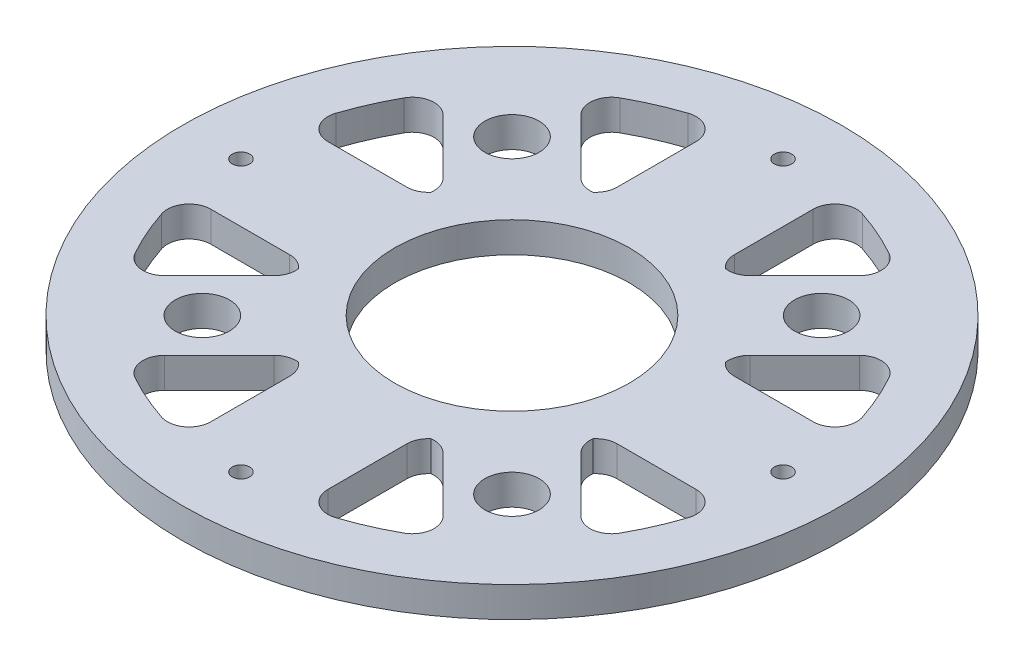
from build123d import *

# Parameters (mm, degrees)
SKETCH1_R           = 76
SKETCH1_R_2         = 27.051
SKETCH1_R_3         = 2
BOSS_EXTRUDE1_DEPTH = 7
SKETCH4_R           = 6.25
CUT_EXTRUDE1_DEPTH  = 10
FILLET1_R           = 5


with BuildPart() as part:
    # Sketch1 → Boss-Extrude1 (new body)
    with BuildSketch(Plane(origin=(0, 0, 0), x_dir=(1, 0, 0), z_dir=(0, 1, 0))):
        with Locations(Location((0, 0, 0), (0, 0, 270))):
            Circle(SKETCH1_R)
        with Locations(Location((0, 0, 0), (0, 0, 270))):
            Circle(SKETCH1_R_2, mode=Mode.SUBTRACT)
        with Locations(Location((0, 62.5, 0), (0, 0, 270))):
            Circle(SKETCH1_R_3, mode=Mode.SUBTRACT)
        with Locations(Location((62.5, 0, 0), (0, 0, 270))):
            Circle(SKETCH1_R_3, mode=Mode.SUBTRACT)
        with Locations(Location((0, -62.5, 0), (0, 0, 270))):
            Circle(SKETCH1_R_3, mode=Mode.SUBTRACT)
        with Locations(Location((-62.5, 0, 0), (0, 0, 270))):
            Circle(SKETCH1_R_3, mode=Mode.SUBTRACT)
    extrude(amount=BOSS_EXTRUDE1_DEPTH)

    # Sketch4 → Cut-Extrude1 (cut)
    with BuildSketch(Plane(origin=(0, 7, 0), x_dir=(1, 0, 0), z_dir=(0, 1, 0))):
        with BuildLine():
            Line((27.751246841, -43.661149418), (17.007161012, -32.917063589))
            ThreePointArc((17.007161012, -32.917063589), (15.274204293, -33.756114768), (13.5, -34.504008477))
            Line((13.5, -34.504008477), (13.5, -62.5))
            ThreePointArc((13.5, -62.5), (25.524772494, -58.625813335), (36.553123822, -52.463026398))
            Line((36.553123822, -52.463026398), (27.751246841, -43.661149418))
        make_face()
        with BuildLine():
            Line((62.5, -13.5), (34.504008477, -13.5))
            ThreePointArc((34.504008477, -13.5), (33.756114768, -15.274204293), (32.917063589, -17.007161012))
            Line((32.917063589, -17.007161012), (43.66114941, -27.751246833))
            Line((43.66114941, -27.751246833), (52.463026398, -36.553123822))
            ThreePointArc((52.463026398, -36.553123822), (58.625813335, -25.524772494), (62.5, -13.5))
        make_face()
        with BuildLine():
            ThreePointArc((-13.5, -34.504008477), (-15.274204293, -33.756114768), (-17.007161012, -32.917063589))
            Line((-17.007161012, -32.917063589), (-27.751246874, -43.66114945))
            Line((-27.751246874, -43.66114945), (-36.553123822, -52.463026398))
            ThreePointArc((-36.553123822, -52.463026398), (-25.524772494, -58.625813335), (-13.5, -62.5))
            Line((-13.5, -62.5), (-13.5, -34.504008477))
        make_face()
        with BuildLine():
            ThreePointArc((-32.917063589, -17.007161012), (-33.756114768, -15.274204293), (-34.504008477, -13.5))
            Line((-34.504008477, -13.5), (-62.5, -13.5))
            ThreePointArc((-62.5, -13.5), (-58.625813335, -25.524772494), (-52.463026398, -36.553123822))
            Line((-52.463026398, -36.553123822), (-43.661149471, -27.751246894))
            Line((-43.661149471, -27.751246894), (-32.917063589, -17.007161012))
        make_face()
        with BuildLine():
            ThreePointArc((-34.504008477, 13.5), (-33.756114768, 15.274204293), (-32.917063589, 17.007161012))
            Line((-32.917063589, 17.007161012), (-43.66114943, 27.751246854))
            Line((-43.66114943, 27.751246854), (-52.463026398, 36.553123822))
            ThreePointArc((-52.463026398, 36.553123822), (-58.625813335, 25.524772494), (-62.5, 13.5))
            Line((-62.5, 13.5), (-34.504008477, 13.5))
        make_face()
        with BuildLine():
            ThreePointArc((-17.007161012, 32.917063589), (-15.274204293, 33.756114768), (-13.5, 34.504008477))
            Line((-13.5, 34.504008477), (-13.5, 62.5))
            ThreePointArc((-13.5, 62.5), (-25.524772494, 58.625813335), (-36.553123822, 52.463026398))
            Line((-36.553123822, 52.463026398), (-27.751246874, 43.66114945))
            Line((-27.751246874, 43.66114945), (-17.007161012, 32.917063589))
        make_face()
        with BuildLine():
            ThreePointArc((36.553123822, 52.463026398), (25.524772494, 58.625813335), (13.5, 62.5))
            Line((13.5, 62.5), (13.5, 34.504008477))
            ThreePointArc((13.5, 34.504008477), (15.274204293, 33.756114768), (17.007161012, 32.917063589))
            Line((17.007161012, 32.917063589), (27.751246906, 43.661149483))
            Line((27.751246906, 43.661149483), (36.553123822, 52.463026398))
        make_face()
        with BuildLine():
            ThreePointArc((62.5, 13.5), (58.625813335, 25.524772494), (52.463026398, 36.553123822))
            Line((52.463026398, 36.553123822), (43.66114945, 27.751246874))
            Line((43.66114945, 27.751246874), (32.917063589, 17.007161012))
            ThreePointArc((32.917063589, 17.007161012), (33.756114768, 15.274204293), (34.504008477, 13.5))
            Line((34.504008477, 13.5), (62.5, 13.5))
        make_face()
        with Locations(Location((35.706198162, 35.706198162, 0), (0, 0, 270))):
            Circle(SKETCH4_R)
        with Locations(Location((35.706198162, -35.706198162, 0), (0, 0, 270))):
            Circle(SKETCH4_R)
        with Locations(Location((-35.706198162, -35.706198162, 0), (0, 0, 270))):
            Circle(SKETCH4_R)
        with Locations(Location((-35.706198162, 35.706198162, 0), (0, 0, 270))):
            Circle(SKETCH4_R)
    extrude(amount=-CUT_EXTRUDE1_DEPTH, mode=Mode.SUBTRACT)

    # Fillet1
    # the kernel refuses this fillet: 5 mm, written as the material it adds along each edge
    with BuildSketch(Plane(origin=(34.504008477, 7, 13.5), x_dir=(1, 0, 0), z_dir=(0, -1, 0)), Plane(origin=(13.5, 7, -34.504008477), x_dir=(0, 0, -1), z_dir=(0, -1, 0)), Plane(origin=(-34.504008477, 7, -13.5), x_dir=(-1, 0, 0), z_dir=(0, -1, 0)), Plane(origin=(-13.5, 7, 34.504008477), x_dir=(0, 0, 1), z_dir=(0, -1, 0))) as fillet1_piece_1:
        with BuildLine():
            CenterArc((3.258891319, 5), FILLET1_R, 206.100178987, 63.899821013)
            ThreePointArc((-1.231239688, 2.800290124), (-0.586707725, 1.412857227), (0, 0))
            Line((0, 0), (3.258891319, 0))
        make_face()
    extrude(amount=7)
    with BuildSketch(Plane(origin=(62.5, 7, 13.5), x_dir=(-1, 0, 0), z_dir=(0, -1, 0))) as fillet1_piece_2:
        with BuildLine():
            CenterArc((6.537189081, -5), FILLET1_R, 90, 108.2926811)
            ThreePointArc((1.789861186, -6.569355874), (0.807426008, -3.308519097), (0, 0))
            Line((0, 0), (6.537189081, 0))
        make_face()
    extrude(amount=7)
    with BuildSketch(Plane(origin=(52.463026398, 7, 36.553123822), x_dir=(-0.7071067811865521, 0, -0.707106781186543), z_dir=(0, -1, 0)), Plane(origin=(-36.553123822, 7, 52.463026398), x_dir=(0.7071067811865515, 0, -0.7071067811865436), z_dir=(0, -1, 0))) as fillet1_piece_3:
        with BuildLine():
            CenterArc((6.286852353, 5), FILLET1_R, 163.996405934, 106.003594066)
            ThreePointArc((1.480630334, 6.378488268), (0.658610883, 3.208210045), (0, 0))
            Line((0, 0), (6.286852353, 0))
        make_face()
    extrude(amount=7)
    with BuildSketch(Plane(origin=(32.917063589, 7, 17.007161012), x_dir=(0.4193809358930841, 0, -0.907810349472532), z_dir=(0, -1, 0)), Plane(origin=(17.007161012, 7, -32.917063589), x_dir=(-0.9078103494725283, 0, -0.41938093589309267), z_dir=(0, -1, 0)), Plane(origin=(-32.917063589, 7, -17.007161012), x_dir=(-0.4193809358930852, 0, 0.9078103494725317), z_dir=(0, -1, 0))) as fillet1_piece_4:
        with BuildLine():
            CenterArc((3.489548398, 4.995132399), FILLET1_R, 200.204490443, 67.267112024)
            Line((-1.202781391, 3.268273647), (0, 0))
            ThreePointArc((0, 0), (1.634487847, 0.036069898), (3.268975694, 0))
        make_face()
    extrude(amount=7)
    with BuildSketch(Plane(origin=(32.917063589, 7, -17.007161012), x_dir=(0.7071067811865526, 0, -0.7071067811865425), z_dir=(0, -1, 0)), Plane(origin=(-17.007161012, 7, -32.917063589), x_dir=(-0.7071067811865506, 0, -0.7071067811865445), z_dir=(0, -1, 0)), Plane(origin=(-32.917063589, 7, 17.007161012), x_dir=(-0.7071067811865506, 0, 0.7071067811865445), z_dir=(0, -1, 0)), Plane(origin=(17.007161012, 7, 32.917063589), x_dir=(0.7071067811865501, 0, 0.707106781186545), z_dir=(0, -1, 0))) as fillet1_piece_5:
        with BuildLine():
            CenterArc((3.482570273, 5), FILLET1_R, 202.732887976, 67.267112024)
            ThreePointArc((-1.129011858, 3.067822406), (-0.530655558, 1.546368727), (0, 0))
            Line((0, 0), (3.482570273, 0))
        make_face()
    extrude(amount=7)
    with BuildSketch(Plane(origin=(34.504008477, 7, -13.5), x_dir=(1, 0, 0), z_dir=(0, -1, 0))) as fillet1_piece_6:
        with BuildLine():
            CenterArc((3.258891319, -5), FILLET1_R, 90, 63.899821013)
            ThreePointArc((-1.231239688, -2.800290124), (-0.586707725, -1.412857227), (0, 0))
            Line((0, 0), (3.258891319, 0))
        make_face()
    extrude(amount=7)
    with BuildSketch(Plane(origin=(62.5, 7, -13.5), x_dir=(-1, 0, 0), z_dir=(0, -1, 0)), Plane(origin=(-13.5, 7, -62.5), x_dir=(0, 0, 1), z_dir=(0, -1, 0)), Plane(origin=(-62.5, 7, 13.5), x_dir=(1, 0, 0), z_dir=(0, -1, 0)), Plane(origin=(13.5, 7, 62.5), x_dir=(0, 0, -1), z_dir=(0, -1, 0))) as fillet1_piece_7:
        with BuildLine():
            CenterArc((6.537189081, 5), FILLET1_R, 161.7073189, 108.2926811)
            ThreePointArc((1.789861186, 6.569355874), (0.807426008, 3.308519097), (0, 0))
            Line((0, 0), (6.537189081, 0))
        make_face()
    extrude(amount=7)
    with BuildSketch(Plane(origin=(52.463026398, 7, -36.553123822), x_dir=(0.5289042688396526, 0, 0.848681491728901), z_dir=(0, -1, 0))) as fillet1_piece_8:
        with BuildLine():
            CenterArc((6.292063112, 4.993441128), FILLET1_R, 166.931450544, 106.003594066)
            Line((1.421561948, 6.124024341), (0, 0))
            ThreePointArc((0, 0), (3.274041034, -0.08387667), (6.548082068, 0))
        make_face()
    extrude(amount=7)
    with BuildSketch(Plane(origin=(36.553123822, 7, -52.463026398), x_dir=(-0.8486814917288963, 0, -0.52890426883966), z_dir=(0, -1, 0)), Plane(origin=(-52.463026398, 7, -36.553123822), x_dir=(-0.5289042688396536, 0, 0.8486814917289003), z_dir=(0, -1, 0))) as fillet1_piece_9:
        with BuildLine():
            CenterArc((6.292063112, -4.993441128), FILLET1_R, 87.06495539, 106.003594066)
            Line((1.421561948, -6.124024341), (0, 0))
            ThreePointArc((0, 0), (3.274041034, 0.08387667), (6.548082068, 0))
        make_face()
    extrude(amount=7)
    with BuildSketch(Plane(origin=(13.5, 7, -62.5), x_dir=(0.9648302017860143, 0, 0.26287388938720957), z_dir=(0, -1, 0)), Plane(origin=(-62.5, 7, -13.5), x_dir=(0.2628738893872084, 0, -0.9648302017860146), z_dir=(0, -1, 0)), Plane(origin=(-13.5, 7, 62.5), x_dir=(-0.9648302017860145, 0, -0.26287388938720885), z_dir=(0, -1, 0))) as fillet1_piece_10:
        with BuildLine():
            CenterArc((6.542607328, 4.992908013), FILLET1_R, 164.759342849, 108.2926811)
            Line((1.718456319, 6.30727746), (0, 0))
            ThreePointArc((0, 0), (3.404410363, -0.090694285), (6.808820725, 0))
        make_face()
    extrude(amount=7)
    with BuildSketch(Plane(origin=(-36.553123822, 7, -52.463026398), x_dir=(0.707106781186552, 0, 0.7071067811865429), z_dir=(0, -1, 0)), Plane(origin=(-52.463026398, 7, 36.553123822), x_dir=(0.7071067811865515, 0, -0.7071067811865436), z_dir=(0, -1, 0)), Plane(origin=(36.553123822, 7, 52.463026398), x_dir=(-0.7071067811865527, 0, -0.7071067811865425), z_dir=(0, -1, 0))) as fillet1_piece_11:
        with BuildLine():
            CenterArc((6.286852353, -5), FILLET1_R, 90, 106.003594066)
            ThreePointArc((1.480630334, -6.378488268), (0.658610883, -3.208210045), (0, 0))
            Line((0, 0), (6.286852353, 0))
        make_face()
    extrude(amount=7)
    with BuildSketch(Plane(origin=(-13.5, 7, -34.504008477), x_dir=(-0.9154220062230544, 0, 0.4024954043496127), z_dir=(0, -1, 0)), Plane(origin=(-34.504008477, 7, 13.5), x_dir=(0.4024954043496181, 0, 0.915422006223052), z_dir=(0, -1, 0)), Plane(origin=(13.5, 7, 34.504008477), x_dir=(0.915422006223051, 0, -0.40249540434962), z_dir=(0, -1, 0))) as fillet1_piece_12:
        with BuildLine():
            CenterArc((3.265421252, 4.995737851), FILLET1_R, 203.734271223, 63.899821013)
            Line((-1.311688779, 2.983260829), (0, 0))
            ThreePointArc((0, 0), (1.52950776, 0.031583378), (3.059015519, 0))
        make_face()
    extrude(amount=7)
    with BuildSketch(Plane(origin=(-17.007161012, 7, 32.917063589), x_dir=(-0.7071067811865496, 0, 0.7071067811865455), z_dir=(0, -1, 0))) as fillet1_piece_13:
        with BuildLine():
            CenterArc((3.482570273, -5), FILLET1_R, 90, 67.267112024)
            ThreePointArc((-1.129011858, -3.067822406), (-0.530655558, -1.546368727), (0, 0))
            Line((0, 0), (3.482570273, 0))
        make_face()
    extrude(amount=7)


solid = part.part
